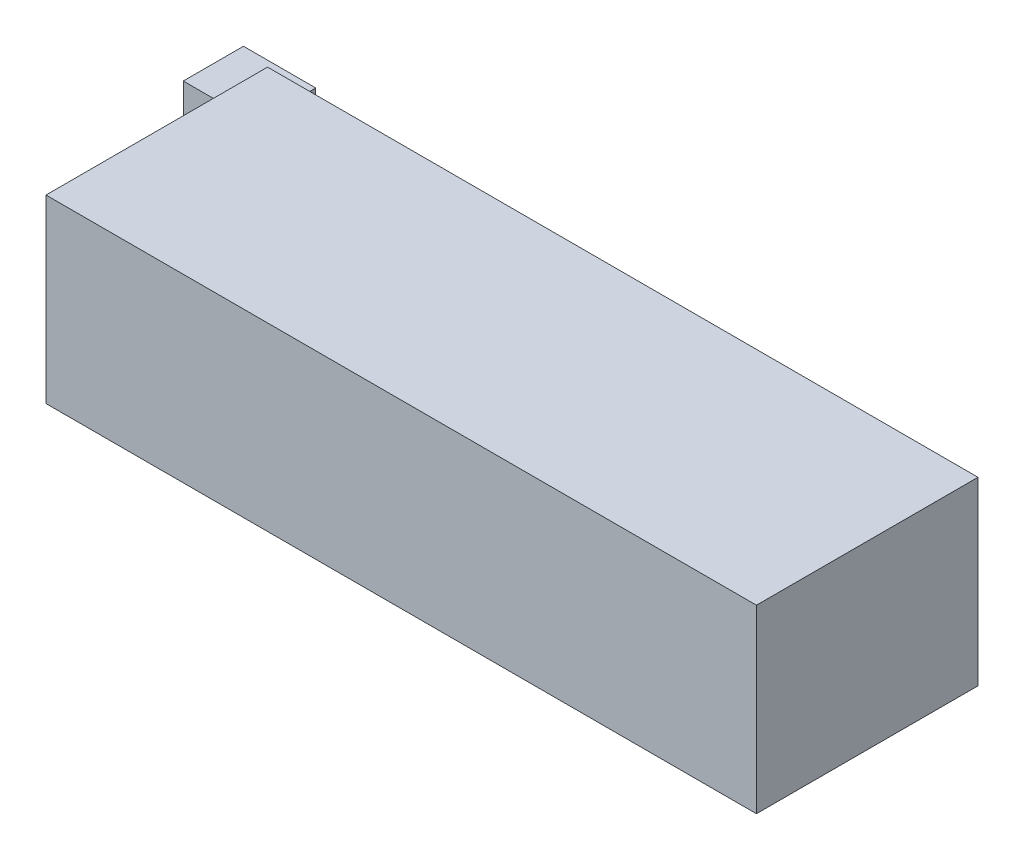
from build123d import *

# Parameters (mm, degrees)
SKETCH1_W           = 74.93
SKETCH1_H           = 23.368
BOSS_EXTRUDE1_DEPTH = 19.05
SKETCH2_W           = 6.35
SKETCH2_H           = 10.16
BOSS_EXTRUDE2_DEPTH = 7.62
FILLET1_R           = 2.54


with BuildPart() as part:
    # Sketch1 → Boss-Extrude1 (new body)
    with BuildSketch(Plane(origin=(0, 0, 0), x_dir=(1, 0, 0), z_dir=(0, 1, 0))):
        with Locations((37.465, -11.684)):
            Rectangle(SKETCH1_W, SKETCH1_H)
    extrude(amount=BOSS_EXTRUDE1_DEPTH)

    # Sketch2 → Boss-Extrude2 (add)
    with BuildSketch(Plane.ZY):
        with Locations((-1.905, 9.525)):
            Rectangle(SKETCH2_W, SKETCH2_H)
    extrude(amount=BOSS_EXTRUDE2_DEPTH)

    # Fillet1
    fillet1_edges = [part.edges().sort_by_distance(p)[0] for p in [
        (0, 9.525, 1.27),
        (0, 9.525, 0),
    ]]
    fillet(fillet1_edges, radius=FILLET1_R)


solid = part.part
